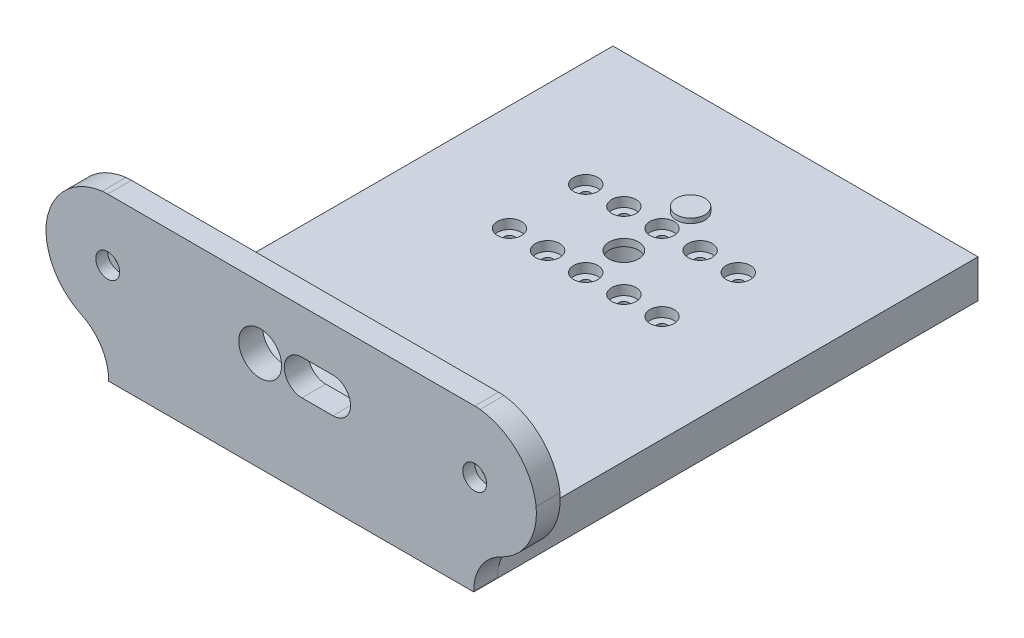
from build123d import *

# Parameters (mm, degrees)
SKETCH_1_W          = 76.6
SKETCH_1_H          = 100.8
SKETCH_1_R          = 3.1
EXTRUDE_1_DEPTH     = 8
SKETCH_2_R          = 5.25
CUT_EXTRUDE_1_DEPTH = 6.5
SKETCH_3_R          = 3
EXTRUDE_2_DEPTH     = 1
SKETCH_5_R          = 1.05
CUT_EXTRUDE_2_DEPTH = 64.804780385
SKETCH_6_R          = 2.55
CUT_EXTRUDE_3_DEPTH = 2
SKETCH_7_R          = 1.125
SKETCH_7_R_2        = 4.5
EXTRUDE_3_DEPTH     = 5
FILLET_1_R          = 10
SKETCH_8_R          = 2.5
CUT_EXTRUDE_4_DEPTH = 2.5


with BuildPart() as part:
    # ｽｹｯﾁ1 → ﾎﾞｽ - 押し出し1 (new body)
    with BuildSketch(Plane(origin=(0, 0, 0), x_dir=(1, 0, 0), z_dir=(0, 1, 0))):
        Rectangle(SKETCH_1_W, SKETCH_1_H)
        with Locations(Location((0, 14.4, 0), (0, 0, 270))):
            Circle(SKETCH_1_R, mode=Mode.SUBTRACT)
    extrude(amount=EXTRUDE_1_DEPTH)

    # ｽｹｯﾁ2 → ｶｯﾄ - 押し出し1 (cut)
    with BuildSketch(Plane.XZ):
        with Locations(Location((0, -14.4, 0), (0, 0, 270))):
            Circle(SKETCH_2_R)
    extrude(amount=-CUT_EXTRUDE_1_DEPTH, mode=Mode.SUBTRACT)

    # ｽｹｯﾁ3 → ﾎﾞｽ - 押し出し2 (add)
    with BuildSketch(Plane(origin=(0, 8, 0), x_dir=(1, 0, 0), z_dir=(0, 1, 0))):
        with Locations(Location((0, 28.4, 0), (0, 0, 270))):
            Circle(SKETCH_3_R)
    extrude(amount=EXTRUDE_2_DEPTH)

    # ｽｹｯﾁ5 → ｶｯﾄ - 押し出し2 (cut, through all)
    with BuildSketch(Plane(origin=(0, 8, 0), x_dir=(1, 0, 0), z_dir=(0, 1, 0))):
        with Locations(Location((0, 22.4, 0), (0, 0, 270))):
            Circle(SKETCH_5_R)
        with Locations(Location((8, 22.4, 0), (0, 0, 270))):
            Circle(SKETCH_5_R)
        with Locations(Location((16, 22.4, 0), (0, 0, 270))):
            Circle(SKETCH_5_R)
        with Locations(Location((-8, 22.4, 0), (0, 0, 270))):
            Circle(SKETCH_5_R)
        with Locations(Location((-16, 22.4, 0), (0, 0, 270))):
            Circle(SKETCH_5_R)
        with Locations(Location((-16, 6.4, 0), (0, 0, 90))):
            Circle(SKETCH_5_R)
        with Locations(Location((-8, 6.4, 0), (0, 0, 90))):
            Circle(SKETCH_5_R)
        with Locations(Location((16, 6.4, 0), (0, 0, 90))):
            Circle(SKETCH_5_R)
        with Locations(Location((8, 6.4, 0), (0, 0, 90))):
            Circle(SKETCH_5_R)
        with Locations(Location((0, 6.4, 0), (0, 0, 90))):
            Circle(SKETCH_5_R)
    extrude(amount=-CUT_EXTRUDE_2_DEPTH, mode=Mode.SUBTRACT)

    # ｽｹｯﾁ6 → ｶｯﾄ - 押し出し3 (cut)
    with BuildSketch(Plane(origin=(0, 8, 0), x_dir=(1, 0, 0), z_dir=(0, 1, 0))):
        with Locations(Location((-8, 22.4, 0), (0, 0, 270))):
            Circle(SKETCH_6_R)
        with Locations(Location((-16, 22.4, 0), (0, 0, 270))):
            Circle(SKETCH_6_R)
        with Locations(Location((0, 22.4, 0), (0, 0, 270))):
            Circle(SKETCH_6_R)
        with Locations(Location((8, 22.4, 0), (0, 0, 270))):
            Circle(SKETCH_6_R)
        with Locations(Location((16, 22.4, 0), (0, 0, 270))):
            Circle(SKETCH_6_R)
        with Locations(Location((-8, 6.4, 0), (0, 0, 270))):
            Circle(SKETCH_6_R)
        with Locations(Location((0, 6.4, 0), (0, 0, 270))):
            Circle(SKETCH_6_R)
        with Locations(Location((8, 6.4, 0), (0, 0, 270))):
            Circle(SKETCH_6_R)
        with Locations(Location((16, 6.4, 0), (0, 0, 270))):
            Circle(SKETCH_6_R)
        with Locations(Location((-16, 6.4, 0), (0, 0, 270))):
            Circle(SKETCH_6_R)
    extrude(amount=-CUT_EXTRUDE_3_DEPTH, mode=Mode.SUBTRACT)

    # ｽｹｯﾁ7 → ﾎﾞｽ - 押し出し3 (add)
    with BuildSketch(Plane.XY.offset(50.4)):
        with BuildLine():
            Line((-38.3, 0), (38.3, 0))
            Line((38.3, 0), (38.3, 8))
            Line((38.3, 8), (38.5, 8))
            ThreePointArc((38.5, 8), (48.054475131, 12.20846095), (51.398967948, 22.098532052))
            ThreePointArc((51.398967948, 22.098532052), (47.545941546, 29.995941546), (39.648532052, 33.848967948))
            ThreePointArc((39.648532052, 33.848967948), (39.074832616, 33.887235696), (38.5, 33.9))
            Line((38.5, 33.9), (-38.5, 33.9))
            ThreePointArc((-38.5, 33.9), (-39.074832616, 33.887235696), (-39.648532052, 33.848967948))
            ThreePointArc((-39.648532052, 33.848967948), (-47.545941546, 29.995941546), (-51.398967948, 22.098532052))
            ThreePointArc((-51.398967948, 22.098532052), (-48.054475131, 12.20846095), (-38.5, 8))
            Line((-38.5, 8), (-38.3, 8))
            Line((-38.3, 8), (-38.3, 0))
        make_face()
        with Locations((-38.5, 20.95)):
            Circle(SKETCH_7_R, mode=Mode.SUBTRACT)
        with Locations((-6.5, 20.95)):
            Circle(SKETCH_7_R_2, mode=Mode.SUBTRACT)
        with Locations((38.5, 20.95)):
            Circle(SKETCH_7_R, mode=Mode.SUBTRACT)
        with BuildLine():
            Line((8.75, 24.65), (2.25, 24.65))
            ThreePointArc((2.25, 24.65), (-1.45, 20.95), (2.25, 17.25))
            Line((2.25, 17.25), (8.75, 17.25))
            ThreePointArc((8.75, 17.25), (12.45, 20.95), (8.75, 24.65))
        make_face(mode=Mode.SUBTRACT)
    extrude(amount=EXTRUDE_3_DEPTH)

    # ﾌｨﾚｯﾄ1
    # the kernel refuses this fillet: 10 mm, written as the material it adds along each edge
    with BuildSketch(Plane(origin=(-38.3, 8, 50.4), x_dir=(-0.97737367120093, 0.21151999159232296, 0), z_dir=(0, 0, 1))) as fillet_1_piece_1:
        with BuildLine():
            CenterArc((8.12337112, 9.741069532), FILLET_1_R, 192.211442518, 64.721710974)
            Line((-1.650365592, 7.625869616), (-2.627739263, 7.414349624))
            Line((-2.627739263, 7.414349624), (-0.977373671, -0.211519992))
            Line((-0.977373671, -0.211519992), (0.211519992, -0.977373671))
            ThreePointArc((0.211519992, -0.977373671), (0.406994726, -0.935069673), (5.636406526, -0.974106953))
            Line((5.636406526, -0.974106953), (5.862494216, 0))
        make_face()
    extrude(amount=5)
    with BuildSketch(Plane(origin=(38.3, 8, 50.4), x_dir=(0.9773736712009351, 0.21151999159229984, 0), z_dir=(0, 0, 1))) as fillet_1_piece_2:
        with BuildLine():
            CenterArc((8.12337112, -9.741069532), FILLET_1_R, 103.066846508, 64.721710974)
            Line((-1.650365592, -7.625869616), (-2.627739263, -7.414349624))
            Line((-2.627739263, -7.414349624), (-0.977373671, 0.211519992))
            Line((-0.977373671, 0.211519992), (0.211519992, 0.977373671))
            ThreePointArc((0.211519992, 0.977373671), (0.406994726, 0.935069673), (5.636406526, 0.974106953))
            Line((5.636406526, 0.974106953), (5.862494216, 0))
        make_face()
    extrude(amount=5)

    # ｽｹｯﾁ8 → ｶｯﾄ - 押し出し4 (cut)
    with BuildSketch(Plane.XY.offset(55.4)):
        with Locations((-38.5, 20.95)):
            Circle(SKETCH_8_R)
        with Locations((38.5, 20.95)):
            Circle(SKETCH_8_R)
    extrude(amount=-CUT_EXTRUDE_4_DEPTH, mode=Mode.SUBTRACT)


solid = part.part
